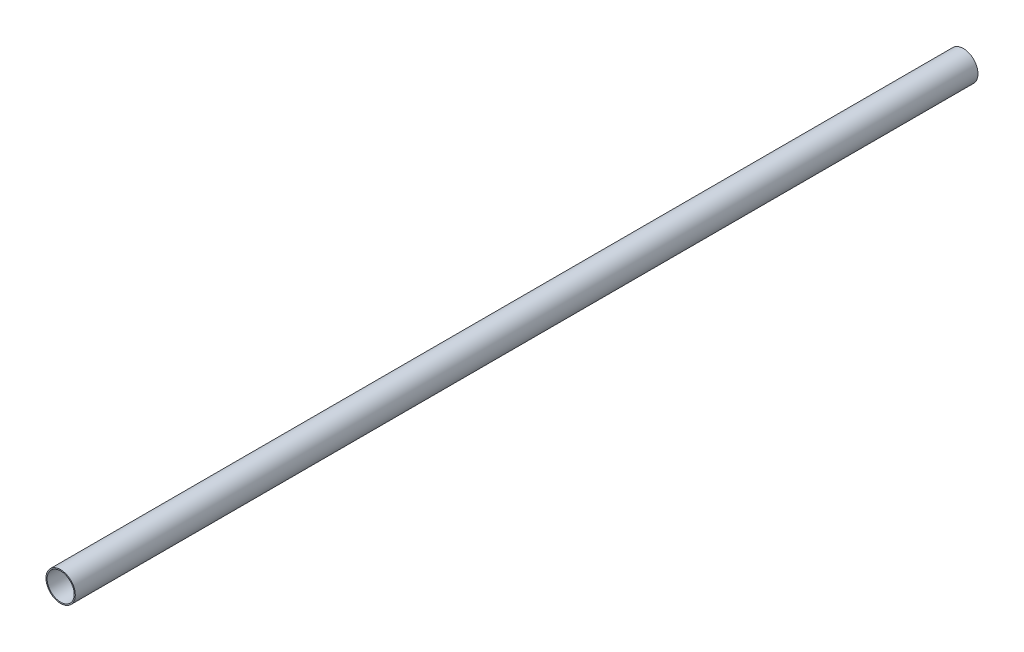
from build123d import *

# Parameters (mm, degrees)
SKETCH1_R           = 6.5
SKETCH1_R_2         = 6
BOSS_EXTRUDE1_DEPTH = 400


with BuildPart() as part:
    # Sketch1 → Boss-Extrude1 (new body)
    with BuildSketch(Plane.XY):
        with Locations((390.7614039, 31.081528881)):
            Circle(SKETCH1_R)
        with Locations((390.7614039, 31.081528881)):
            Circle(SKETCH1_R_2, mode=Mode.SUBTRACT)
    extrude(amount=BOSS_EXTRUDE1_DEPTH)


solid = part.part
